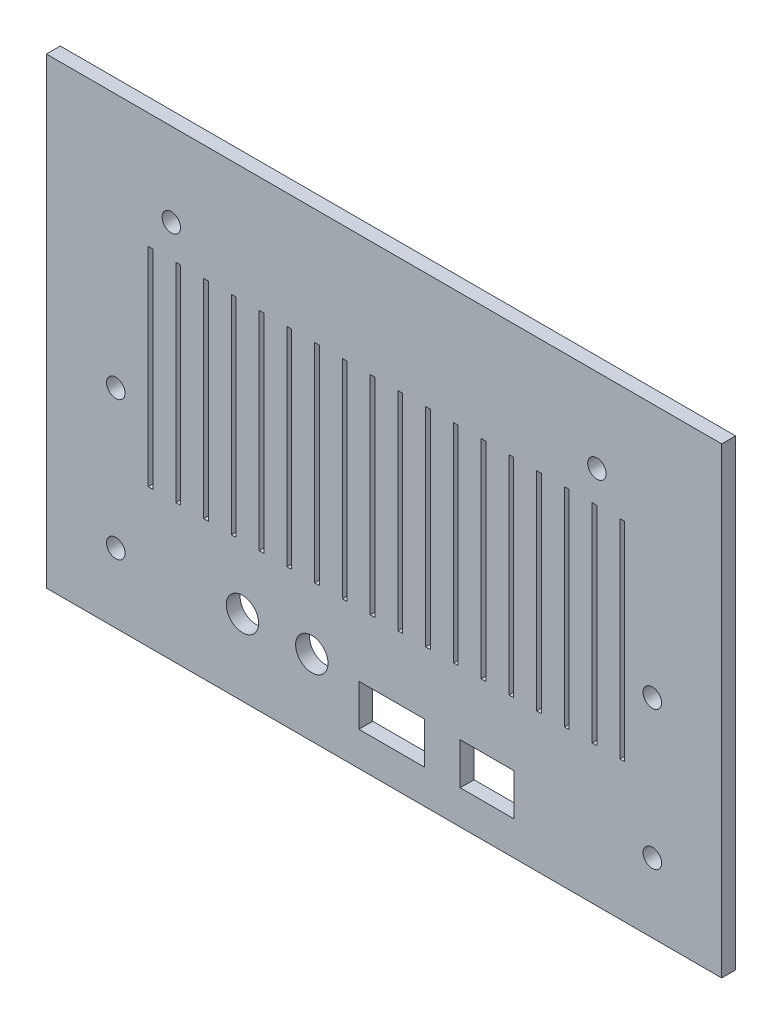
from build123d import *

# Parameters (mm, degrees)
SKETCH1_W           = 146
SKETCH1_H           = 100
BOSS_EXTRUDE1_DEPTH = 3
SKETCH2_W           = 1
SKETCH2_H           = 45
CUT_EXTRUDE1_DEPTH  = 127.121713006
SKETCH3_R           = 2
CUT_EXTRUDE2_DEPTH  = 127.121713006
SKETCH4_W           = 11.62
SKETCH4_H           = 9
CUT_EXTRUDE3_DEPTH  = 127.121713006
SKETCH5_W           = 14.16
SKETCH5_H           = 9
CUT_EXTRUDE4_DEPTH  = 127.121713006
SKETCH6_R           = 3.5
CUT_EXTRUDE5_DEPTH  = 127.121713006
SKETCH8_R           = 2
CUT_EXTRUDE6_DEPTH  = 127.121713006
SKETCH9_R           = 2
CUT_EXTRUDE7_DEPTH  = 127.121713006


with BuildPart() as part:
    # Sketch1 → Boss-Extrude1 (new body)
    with BuildSketch(Plane.XY):
        with Locations((24.755849622, 29.633412311)):
            Rectangle(SKETCH1_W, SKETCH1_H)
    extrude(amount=BOSS_EXTRUDE1_DEPTH)

    # Sketch2 → Cut-Extrude1 (cut, through all)
    with BuildSketch(Plane.XY.offset(3)):
        with Locations((-19.744150378, 32.133412311)):
            Rectangle(SKETCH2_W, SKETCH2_H)
        with Locations((-25.744150378, 32.133412311)):
            Rectangle(SKETCH2_W, SKETCH2_H)
        with Locations((-13.744150378, 32.133412311)):
            Rectangle(SKETCH2_W, SKETCH2_H)
        with Locations((-7.744150378, 32.133412311)):
            Rectangle(SKETCH2_W, SKETCH2_H)
        with Locations((-1.744150378, 32.133412311)):
            Rectangle(SKETCH2_W, SKETCH2_H)
        with Locations((4.255849622, 32.133412311)):
            Rectangle(SKETCH2_W, SKETCH2_H)
        with Locations((10.255849622, 32.133412311)):
            Rectangle(SKETCH2_W, SKETCH2_H)
        with Locations((16.255849622, 32.133412311)):
            Rectangle(SKETCH2_W, SKETCH2_H)
        with Locations((22.255849622, 32.133412311)):
            Rectangle(SKETCH2_W, SKETCH2_H)
        with Locations((34.255849622, 32.133412311)):
            Rectangle(SKETCH2_W, SKETCH2_H)
        with Locations((28.255849622, 32.133412311)):
            Rectangle(SKETCH2_W, SKETCH2_H)
        with Locations((40.255849622, 32.133412311)):
            Rectangle(SKETCH2_W, SKETCH2_H)
        with Locations((46.255849622, 32.133412311)):
            Rectangle(SKETCH2_W, SKETCH2_H)
        with Locations((52.255849622, 32.133412311)):
            Rectangle(SKETCH2_W, SKETCH2_H)
        with Locations((58.255849622, 32.133412311)):
            Rectangle(SKETCH2_W, SKETCH2_H)
        with Locations((64.255849622, 32.133412311)):
            Rectangle(SKETCH2_W, SKETCH2_H)
        with Locations((70.255849622, 32.133412311)):
            Rectangle(SKETCH2_W, SKETCH2_H)
        with Locations((76.255849622, 32.133412311)):
            Rectangle(SKETCH2_W, SKETCH2_H)
    extrude(amount=-CUT_EXTRUDE1_DEPTH, mode=Mode.SUBTRACT)

    # Sketch3 → Cut-Extrude2 (cut, through all)
    with BuildSketch(Plane.XY.offset(3)):
        with Locations((-33.244150378, -5.366587689)):
            Circle(SKETCH3_R)
        with Locations((82.755849622, -5.366587689)):
            Circle(SKETCH3_R)
    extrude(amount=-CUT_EXTRUDE2_DEPTH, mode=Mode.SUBTRACT)

    # Sketch4 → Cut-Extrude3 (cut, through all)
    with BuildSketch(Plane(origin=(0, 0, 0), x_dir=(-1, 0, 0), z_dir=(0, 0, -1))):
        with Locations((-47.025849622, -8.521305626)):
            Rectangle(SKETCH4_W, SKETCH4_H)
    extrude(amount=-CUT_EXTRUDE3_DEPTH, mode=Mode.SUBTRACT)

    # Sketch5 → Cut-Extrude4 (cut, through all)
    with BuildSketch(Plane.XY.offset(3)):
        with Locations((26.385849622, -8.521305626)):
            Rectangle(SKETCH5_W, SKETCH5_H)
    extrude(amount=-CUT_EXTRUDE4_DEPTH, mode=Mode.SUBTRACT)

    # Sketch6 → Cut-Extrude5 (cut, through all)
    with BuildSketch(Plane(origin=(0, 0, 0), x_dir=(-1, 0, 0), z_dir=(0, 0, -1))):
        with Locations((-9.139177798, -4.021305626)):
            Circle(SKETCH6_R)
        with Locations((5.860822202, -4.021305626)):
            Circle(SKETCH6_R)
    extrude(amount=-CUT_EXTRUDE5_DEPTH, mode=Mode.SUBTRACT)

    # Sketch8 → Cut-Extrude6 (cut, through all)
    with BuildSketch(Plane.XY.offset(3)):
        with Locations((82.755849622, 24.633412311)):
            Circle(SKETCH8_R)
        with Locations((-33.244150378, 24.633412311)):
            Circle(SKETCH8_R)
    extrude(amount=-CUT_EXTRUDE6_DEPTH, mode=Mode.SUBTRACT)

    # Sketch9 → Cut-Extrude7 (cut, through all)
    with BuildSketch(Plane.XY.offset(3)):
        with Locations((-21.244150378, 61.633412311)):
            Circle(SKETCH9_R)
        with Locations((70.77306316, 61.532054099)):
            Circle(SKETCH9_R)
    extrude(amount=-CUT_EXTRUDE7_DEPTH, mode=Mode.SUBTRACT)


solid = part.part
